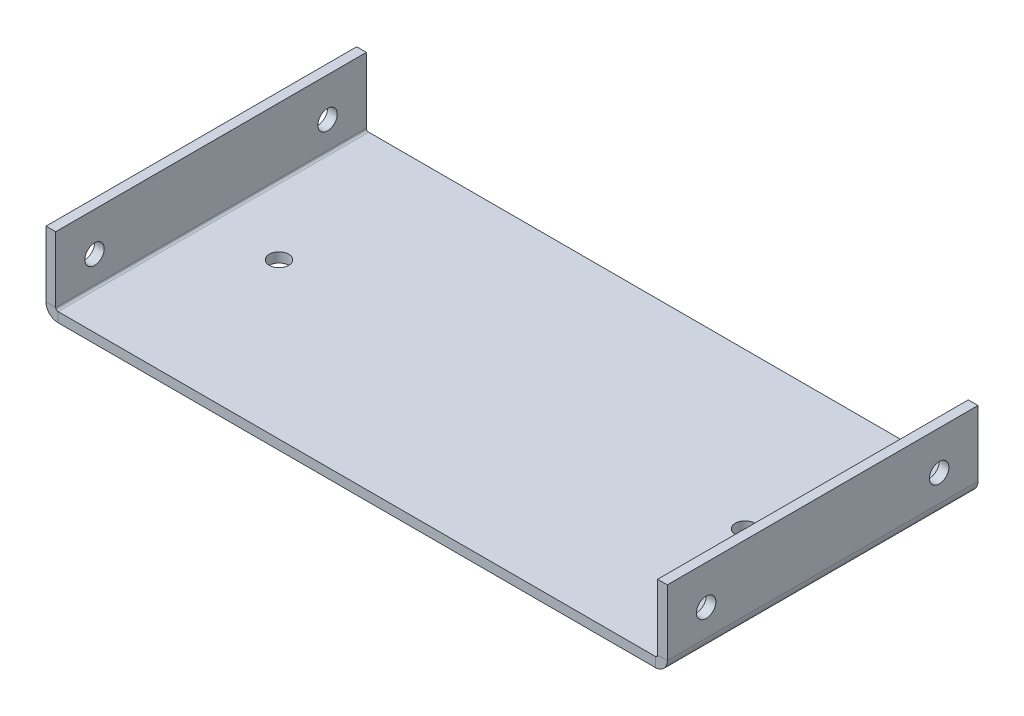
from build123d import *

# Parameters (mm, degrees)
BASE_FLANGE1_OUTLINE_W       = 203.2
BASE_FLANGE1_OUTLINE_H       = 3.175
BASE_FLANGE1_DEPTH           = 101.6
EDGE_FLANGE1_STRIP_W         = 14.1732
EDGE_FLANGE1_STRIP_H         = 3.175
EDGE_FLANGE1_STRIP_CUT_DEPTH = 101.6
EDGE_FLANGE1_DEPTH           = 101.6
EDGE_FLANGE2_STRIP_W         = 14.1732
EDGE_FLANGE2_STRIP_H         = 3.175
EDGE_FLANGE2_STRIP_CUT_DEPTH = 101.6
EDGE_FLANGE2_DEPTH           = 101.6
SKETCH38_R                   = 3.175
CUT_EXTRUDE2_DEPTH           = 229.6
SKETCH45_R                   = 3.175
CUT_EXTRUDE3_DEPTH           = 12.7


# Read off the part's stored shape, not the designer's step: Base-Flange1
# Sheet-metal steps are written as plain solids
with BuildPart() as part:
    # Base-Flange1 outline → Base-Flange1 (new body)
    with BuildSketch(Plane.XY):
        with Locations((-101.6, 1.5875)):
            Rectangle(BASE_FLANGE1_OUTLINE_W, BASE_FLANGE1_OUTLINE_H)
    extrude(amount=BASE_FLANGE1_DEPTH)

    # Edge-Flange1 strip (across the edge) → Edge-Flange1 strip cut (cut)
    with BuildSketch(Plane(origin=(-203.2, 3.175, 0), x_dir=(1, 0, 0), z_dir=(0, 0, 1))):
        with Locations((-3.175, -1.5875)):
            Rectangle(EDGE_FLANGE1_STRIP_W, EDGE_FLANGE1_STRIP_H)
    extrude(amount=EDGE_FLANGE1_STRIP_CUT_DEPTH, mode=Mode.SUBTRACT)

    # Edge-Flange1 section (across the edge) → Edge-Flange1 (add)
    with BuildSketch(Plane(origin=(-203.2, 3.175, 0), x_dir=(1, 0, 0), z_dir=(0, 0, 1))):
        with BuildLine():
            Line((0, 0.7366), (0, 22.225))
            Line((0, 22.225), (3.175, 22.225))
            Line((3.175, 22.225), (3.175, 0.7366))
            ThreePointArc((3.175, 0.7366), (3.390745145, 0.215745145), (3.9116, 0))
            Line((3.9116, 0), (3.9116, -3.175))
            ThreePointArc((3.9116, -3.175), (1.145681115, -2.029318885), (0, 0.7366))
        make_face()
    extrude(amount=EDGE_FLANGE1_DEPTH)

    # Edge-Flange2 strip (across the edge) → Edge-Flange2 strip cut (cut)
    with BuildSketch(Plane(origin=(0, 3.175, 101.6), x_dir=(-1, 0, 0), z_dir=(0, 0, -1))):
        with Locations((-3.175, -1.5875)):
            Rectangle(EDGE_FLANGE2_STRIP_W, EDGE_FLANGE2_STRIP_H)
    extrude(amount=EDGE_FLANGE2_STRIP_CUT_DEPTH, mode=Mode.SUBTRACT)

    # Edge-Flange2 section (across the edge) → Edge-Flange2 (add)
    with BuildSketch(Plane(origin=(0, 3.175, 101.6), x_dir=(-1, 0, 0), z_dir=(0, 0, -1))):
        with BuildLine():
            Line((0, 0.7366), (0, 22.225))
            Line((0, 22.225), (3.175, 22.225))
            Line((3.175, 22.225), (3.175, 0.7366))
            ThreePointArc((3.175, 0.7366), (3.390745145, 0.215745145), (3.9116, 0))
            Line((3.9116, 0), (3.9116, -3.175))
            ThreePointArc((3.9116, -3.175), (1.145681115, -2.029318885), (0, 0.7366))
        make_face()
    extrude(amount=EDGE_FLANGE2_DEPTH)

    # Sketch38 → Cut-Extrude2 (cut, through all)
    with BuildSketch(Plane(origin=(0, 0, 0), x_dir=(0, 0, -1), z_dir=(1, 0, 0))):
        with Locations(Location((-12.7, 12.7, 0), (0, 0, 90))):
            Circle(SKETCH38_R)
        with Locations(Location((-88.9, 12.7, 0), (0, 0, 90))):
            Circle(SKETCH38_R)
    extrude(amount=-CUT_EXTRUDE2_DEPTH, mode=Mode.SUBTRACT)

    # Sketch45 → Cut-Extrude3 (cut)
    with BuildSketch(Plane(origin=(0, 3.175, 0), x_dir=(1, 0, 0), z_dir=(0, 1, 0))):
        with Locations(Location((-177.8, -50.8, 0), (0, 0, 270))):
            Circle(SKETCH45_R)
        with Locations(Location((-25.4, -50.8, 0), (0, 0, 270))):
            Circle(SKETCH45_R)
    extrude(amount=-CUT_EXTRUDE3_DEPTH, mode=Mode.SUBTRACT)


solid = part.part
